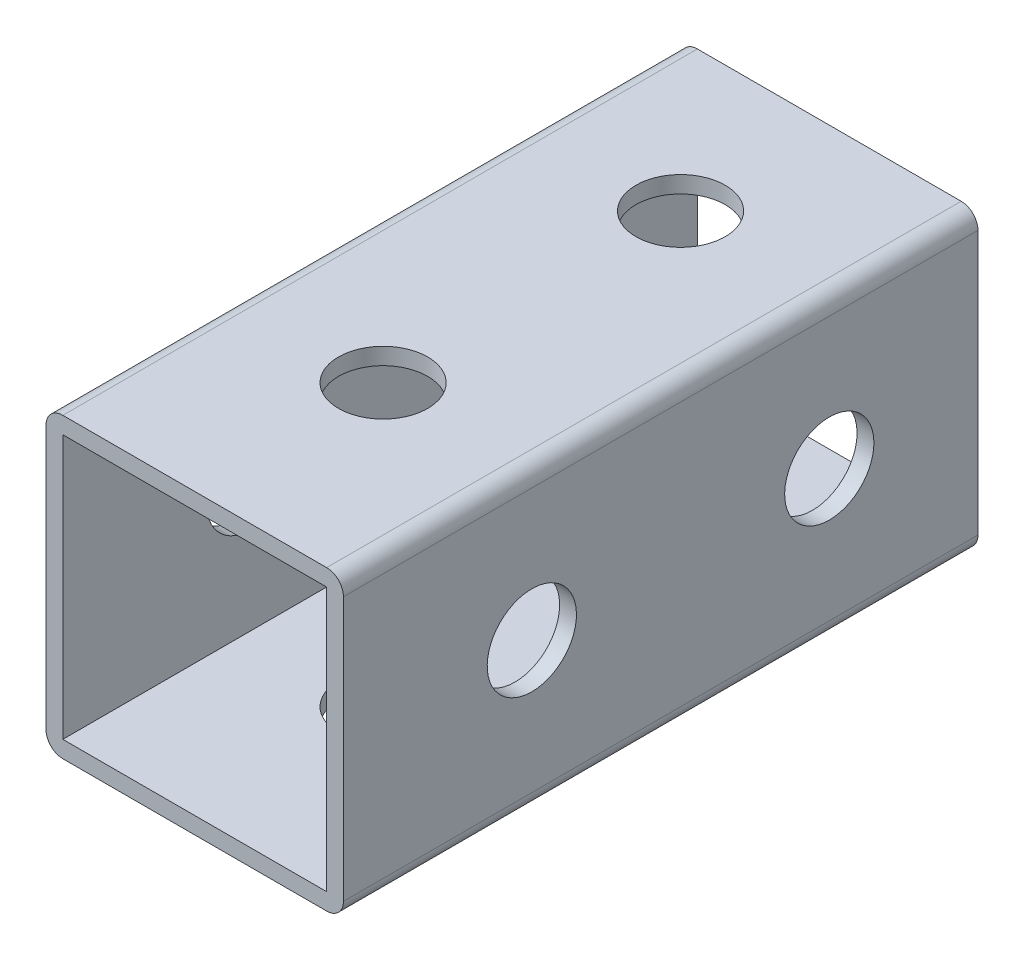
from build123d import *

# Parameters (mm, degrees)
SKETCH1_W                 = 42.2402
SKETCH1_H                 = 42.2402
BASE_EXTRUDE_DEPTH        = 101.6
HOLE1_START               = -23.8125
HOLE1_OUTLINE_R           = 7.14375
HOLE1_DEPTH               = 47.625
CIRPATTERN2_COUNT         = 2
CIRPATTERN2_ANGLE         = 90
LPATTERN1_COUNT           = 2
LPATTERN1_PITCH           = 47.625
LPATTERN1_START           = -23.8125
LPATTERN1_COPY_1_SKETCH_R = 7.14375
LPATTERN1_COPY_1_DEPTH    = 47.625


# Read off the part's stored shape, not the designer's step: Hole1
with BuildPart() as part:
    # Sketch1 → Base-Extrude (new body)
    with BuildSketch(Plane.XY):
        with BuildLine():
            Line((-23.8125, 21.1201), (-23.8125, -21.1201))
            ThreePointArc((-23.8125, -21.1201), (-23.023914298, -23.023914298), (-21.1201, -23.8125))
            Line((-21.1201, -23.8125), (21.1201, -23.8125))
            ThreePointArc((21.1201, -23.8125), (23.023914298, -23.023914298), (23.8125, -21.1201))
            Line((23.8125, -21.1201), (23.8125, 21.1201))
            ThreePointArc((23.8125, 21.1201), (23.023914298, 23.023914298), (21.1201, 23.8125))
            Line((21.1201, 23.8125), (-21.1201, 23.8125))
            ThreePointArc((-21.1201, 23.8125), (-23.023914298, 23.023914298), (-23.8125, 21.1201))
        make_face()
        Rectangle(SKETCH1_W, SKETCH1_H, mode=Mode.SUBTRACT)
    extrude(amount=BASE_EXTRUDE_DEPTH)

    # Hole1 outline → Hole1 (cut)
    with BuildSketch(Plane(origin=(0, 0, 0), x_dir=(1, 0, 0), z_dir=(0, 1, 0)).offset(HOLE1_START)):
        with Locations((0, -23.8125)):
            Circle(HOLE1_OUTLINE_R)
    hole1 = extrude(amount=HOLE1_DEPTH, mode=Mode.SUBTRACT)

    # CirPattern2: Hole1 ×2 about axis
    cirpattern2_axis = Axis((0, 0, -50), (0, 0, 1))
    for i in range(1, CIRPATTERN2_COUNT):
        add(hole1.rotate(cirpattern2_axis, i * CIRPATTERN2_ANGLE / (CIRPATTERN2_COUNT - 1)), mode=Mode.SUBTRACT)

    # LPattern1: Hole1 ×2
    with Locations(*[(0, 0, i * LPATTERN1_PITCH) for i in range(1, LPATTERN1_COUNT)]):
        add(hole1, mode=Mode.SUBTRACT)

    # LPattern1 copy 1 sketch → LPattern1 copy 1 (cut)
    with BuildSketch(Plane(origin=(0, 0, 47.625), x_dir=(0, 1, 0), z_dir=(-1, 0, 0)).offset(LPATTERN1_START)):
        with Locations((0, -23.8125)):
            Circle(LPATTERN1_COPY_1_SKETCH_R)
    extrude(amount=LPATTERN1_COPY_1_DEPTH, mode=Mode.SUBTRACT)


solid = part.part
